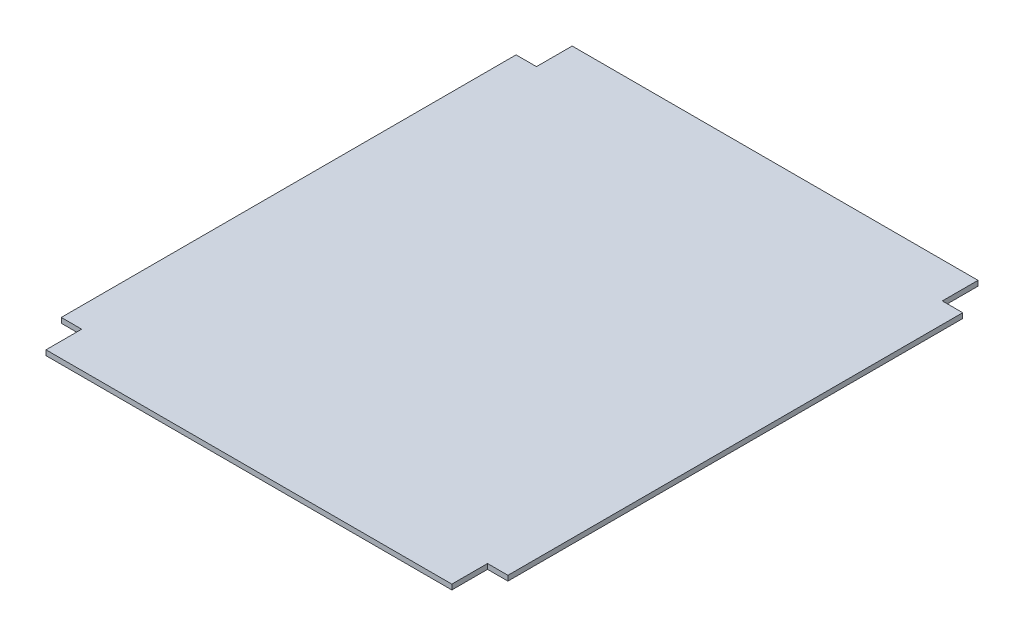
from build123d import *

# Parameters (mm, degrees)
BOSS_EXTRUDE1_DEPTH = 0.5


with BuildPart() as part:
    # Sketch1 → Boss-Extrude1 (new body)
    with BuildSketch(Plane(origin=(0, 0, 0), x_dir=(1, 0, 0), z_dir=(0, 1, 0))):
        Polygon((0, 0), (0, 3.5), (-2, 3.5), (-2, 48.1), (0, 48.1), (0, 51.6), (39.8, 51.6), (39.8, 48.1), (41.8, 48.1), (41.8, 3.5), (39.8, 3.5), (39.8, 0), align=None)
    extrude(amount=BOSS_EXTRUDE1_DEPTH)


solid = part.part
